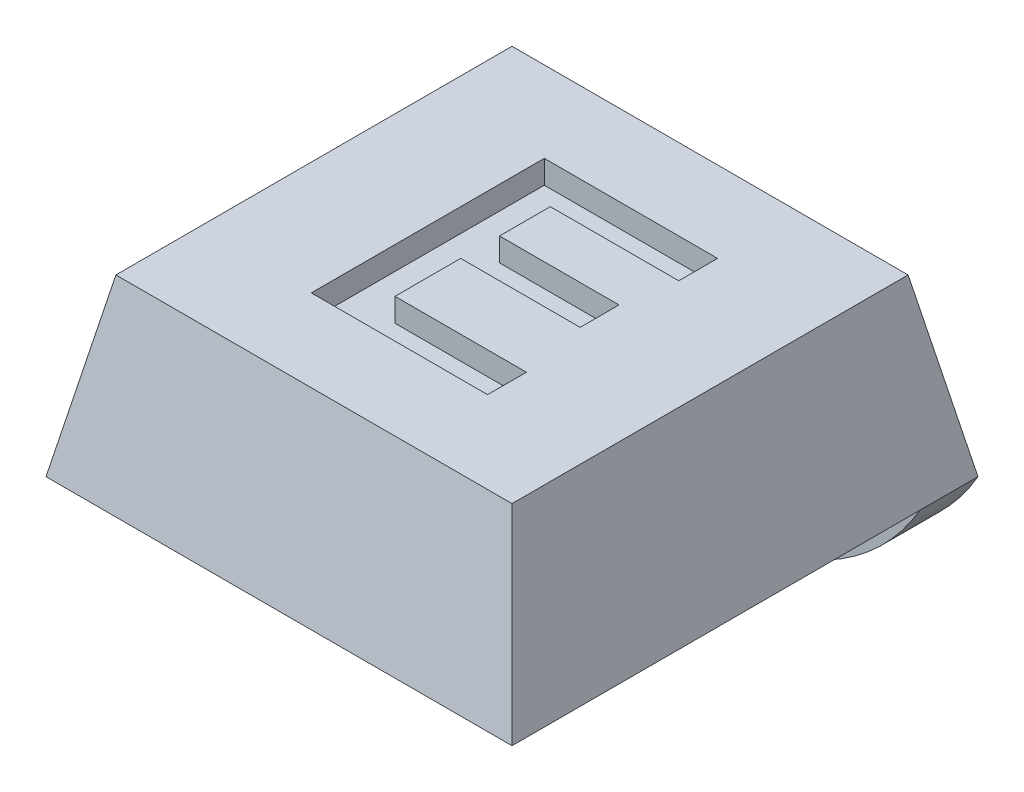
from build123d import *

# Parameters (mm, degrees)
SKETCH1_W               = 8
SKETCH1_H               = 8
BOSS_EXTRUDE1_DEPTH     = 3
CUT_EXTRUDE1_DEPTH      = 12.704699911
CUT_EXTRUDE1_DEPTH_BACK = 12.704699911
CUT_EXTRUDE2_DEPTH      = 11
SKETCH4_R               = 1.8
CUT_EXTRUDE3_DEPTH      = 0.8
SKETCH5_W               = 8
SKETCH5_H               = 1
BOSS_EXTRUDE2_DEPTH     = 2
FILLET1_R               = 4
CUT_EXTRUDE4_DEPTH      = 0.4


with BuildPart() as part:
    # Sketch1 → Boss-Extrude1 (new body)
    with BuildSketch(Plane(origin=(0, 0, 0), x_dir=(1, 0, 0), z_dir=(0, 1, 0))):
        with Locations((4, 4)):
            Rectangle(SKETCH1_W, SKETCH1_H)
    extrude(amount=BOSS_EXTRUDE1_DEPTH)

    # Sketch2 → Cut-Extrude1 (cut, two sides: drawn at the far end of the back side and taken through both)
    with BuildSketch(Plane.XY.offset(-CUT_EXTRUDE1_DEPTH_BACK)):
        Polygon((0, 0), (0.6, 3), (0, 3), align=None)
        Polygon((8, 0), (7.4, 3), (8, 3), align=None)
    extrude(amount=CUT_EXTRUDE1_DEPTH + CUT_EXTRUDE1_DEPTH_BACK, mode=Mode.SUBTRACT)

    # Sketch3 → Cut-Extrude2 (cut)
    with BuildSketch(Plane(origin=(0, 0, 0), x_dir=(0, 0, -1), z_dir=(1, 0, 0))):
        Polygon((0, 0), (0.6, 3), (0, 3), align=None)
        Polygon((8, 3), (7.4, 3), (8, 0), align=None)
    extrude(amount=CUT_EXTRUDE2_DEPTH, mode=Mode.SUBTRACT)

    # Sketch4 → Cut-Extrude3 (cut)
    with BuildSketch(Plane.XZ):
        with Locations(Location((4, -3.75, 0), (0, 0, 270))):
            Circle(SKETCH4_R)
    extrude(amount=-CUT_EXTRUDE3_DEPTH, mode=Mode.SUBTRACT)

    # Sketch5 → Boss-Extrude2 (add)
    with BuildSketch(Plane.XZ):
        with Locations((4, -7.5)):
            Rectangle(SKETCH5_W, SKETCH5_H)
    extrude(amount=BOSS_EXTRUDE2_DEPTH)

    # Fillet1
    # the kernel refuses this fillet: 4 mm, written as the material it takes off along each edge
    with BuildSketch(Plane(origin=(8, -2, -16.660254038), x_dir=(0, 1, 0), z_dir=(0, 0, 1)), Plane(origin=(0, -2, 1.660254038), x_dir=(0, 1, 0), z_dir=(0, 0, -1))) as fillet1_piece_1:
        with BuildLine():
            CenterArc((4, 3.464101615), FILLET1_R, 180, 60)
            Line((0, 3.464101615), (-0.08, 3.464101615))
            Line((-0.08, 3.464101615), (-0.08, 0))
            Line((-0.08, 0), (0, -0.08))
            ThreePointArc((0, -0.08), (1, -0.08), (1.96, -0.069282032))
            Line((1.96, -0.069282032), (2, 0))
        make_face()
    extrude(amount=18.320508076, mode=Mode.SUBTRACT)

    # Sketch6 → Cut-Extrude4 (cut)
    with BuildSketch(Plane(origin=(0, 3, 0), x_dir=(1, 0, 0), z_dir=(0, 1, 0))):
        Polygon((2.544225106, 2.010567225), (2.544225106, 6.010567225), (5.51858408, 6.010567225), (5.51858408, 5.343900558), (3.313455875, 5.343900558), (3.313455875, 4.472105686), (5.364737926, 4.472105686), (5.364737926, 3.80543902), (3.313455875, 3.80543902), (3.313455875, 2.677233891), (5.569866131, 2.677233891), (5.569866131, 2.010567225), align=None)
    extrude(amount=-CUT_EXTRUDE4_DEPTH, mode=Mode.SUBTRACT)


solid = part.part
